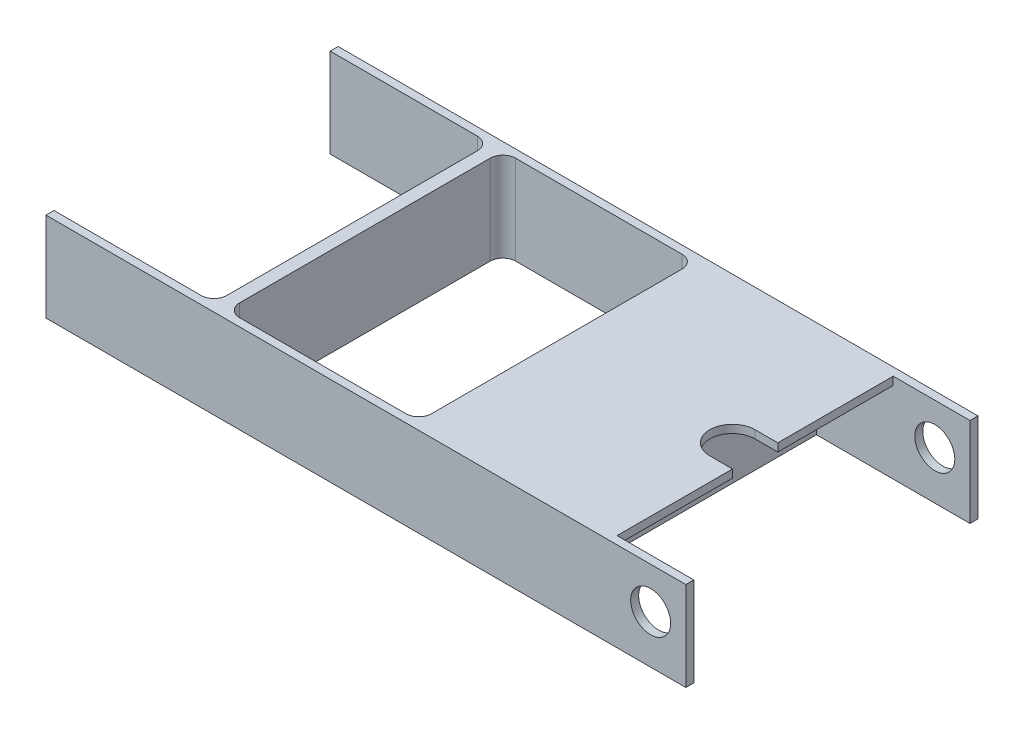
from build123d import *

# Parameters (mm, degrees)
SKETCH1_W               = 127
SKETCH1_H               = 57.9882
BOSS_EXTRUDE1_DEPTH     = 17.70126
SKETCH2_W               = 15.24
SKETCH2_H               = 54.8132
CUT_EXTRUDE1_DEPTH      = 73.015570819
CUT_EXTRUDE2_DEPTH      = 87.756115439
CUT_EXTRUDE2_DEPTH_BACK = 87.756115439
SKETCH3_R               = 3.96875
CUT_EXTRUDE5_DEPTH      = 117.808775528
CUT_EXTRUDE5_DEPTH_BACK = 15.24
SKETCH6_W               = 54.8132
SKETCH6_H               = 16.11376
CUT_EXTRUDE6_DEPTH      = 73.015570819
SKETCH7_W               = 31.75
SKETCH7_H               = 54.8132
CUT_EXTRUDE7_DEPTH      = 73.015570819
SKETCH8_W               = 38.1
SKETCH8_H               = 54.8132
CUT_EXTRUDE8_DEPTH      = 73.015570819
FILLET2_R               = 2.54


with BuildPart() as part:
    # Sketch1 → Boss-Extrude1 (new body)
    with BuildSketch(Plane(origin=(0, 0, 0), x_dir=(1, 0, 0), z_dir=(0, 1, 0))):
        Rectangle(SKETCH1_W, SKETCH1_H)
    extrude(amount=BOSS_EXTRUDE1_DEPTH)

    # Sketch2 → Cut-Extrude1 (cut, through all)
    with BuildSketch(Plane(origin=(0, 17.70126, 0), x_dir=(1, 0, 0), z_dir=(0, 1, 0))):
        with Locations((55.88, 0)):
            Rectangle(SKETCH2_W, SKETCH2_H)
    extrude(amount=-CUT_EXTRUDE1_DEPTH, mode=Mode.SUBTRACT)

    # Sketch3 → Cut-Extrude2 (cut, two sides: drawn at the far end of the back side and taken through both)
    with BuildSketch(Plane.XY.offset(-27.4066).offset(-CUT_EXTRUDE2_DEPTH_BACK)):
        with Locations((56.515, 9.54786)):
            Circle(SKETCH3_R)
    extrude(amount=CUT_EXTRUDE2_DEPTH + CUT_EXTRUDE2_DEPTH_BACK, mode=Mode.SUBTRACT)

    # Sketch6 → Cut-Extrude5 (cut, two sides: drawn at the far end of the back side and taken through both)
    with BuildSketch(Plane(origin=(48.26, 0, 0), x_dir=(0, 0, -1), z_dir=(1, 0, 0)).offset(-CUT_EXTRUDE5_DEPTH_BACK)):
        with Locations((0, 8.05688)):
            Rectangle(SKETCH6_W, SKETCH6_H)
    extrude(amount=CUT_EXTRUDE5_DEPTH + CUT_EXTRUDE5_DEPTH_BACK, mode=Mode.SUBTRACT)

    # Sketch4 → Cut-Extrude6 (cut, through all)
    with BuildSketch(Plane(origin=(0, 17.70126, 0), x_dir=(1, 0, 0), z_dir=(0, 1, 0))):
        with BuildLine():
            ThreePointArc((43.759999983, 4.500000017), (39.259999966, 0), (43.759999983, -4.500000017))
            Line((43.759999983, -4.500000017), (48.26, -4.500000017))
            Line((48.26, -4.500000017), (48.26, 4.500000017))
            Line((48.26, 4.500000017), (43.759999983, 4.500000017))
        make_face()
    extrude(amount=-CUT_EXTRUDE6_DEPTH, mode=Mode.SUBTRACT)

    # Sketch7 → Cut-Extrude7 (cut, through all)
    with BuildSketch(Plane(origin=(0, 17.70126, 0), x_dir=(1, 0, 0), z_dir=(0, 1, 0))):
        with Locations((-47.625, 0)):
            Rectangle(SKETCH7_W, SKETCH7_H)
    extrude(amount=-CUT_EXTRUDE7_DEPTH, mode=Mode.SUBTRACT)

    # Sketch8 → Cut-Extrude8 (cut, through all)
    with BuildSketch(Plane(origin=(0, 17.70126, 0), x_dir=(1, 0, 0), z_dir=(0, 1, 0))):
        with Locations((-10.16, 0)):
            Rectangle(SKETCH8_W, SKETCH8_H)
    extrude(amount=-CUT_EXTRUDE8_DEPTH, mode=Mode.SUBTRACT)

    # Fillet2
    fillet2_edges = [part.edges().sort_by_distance(p)[0] for p in [
        (-29.21, 8.85063, 27.4066),
        (-31.75, 8.85063, 27.4066),
        (8.89, 8.85063, 27.4066),
        (8.89, 8.85063, -27.4066),
        (-29.21, 8.85063, -27.4066),
        (-31.75, 8.85063, -27.4066),
    ]]
    fillet(fillet2_edges, radius=FILLET2_R)


solid = part.part
